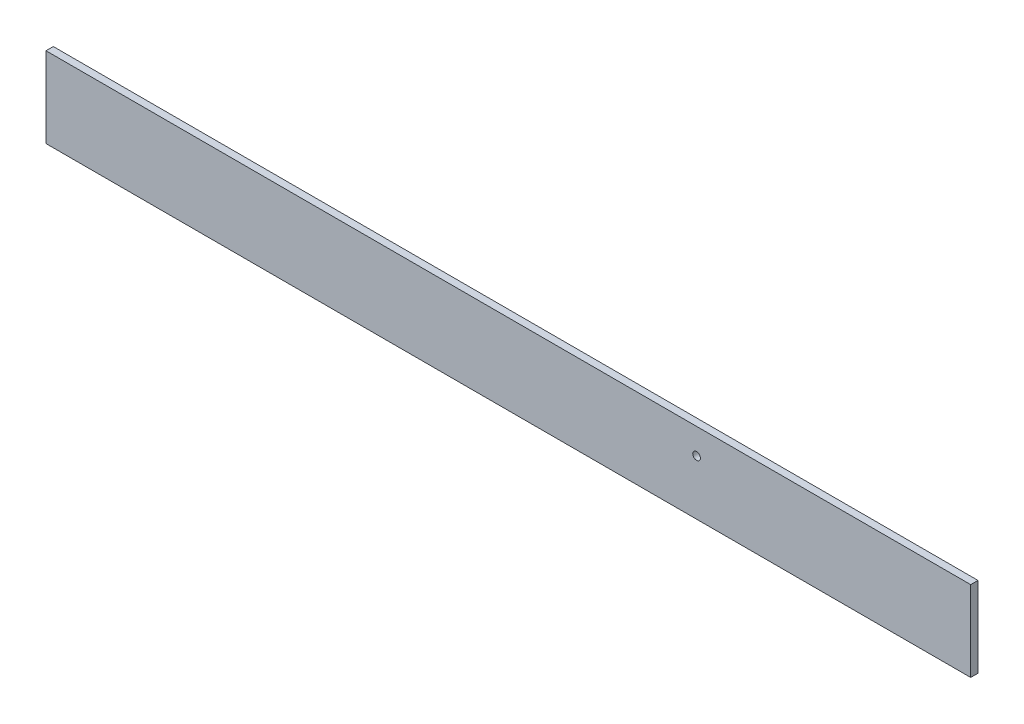
from build123d import *

# Parameters (mm, degrees)
SKETCH2_W           = 506
SKETCH2_H           = 44
SKETCH2_R           = 2.1
BOSS_EXTRUDE1_DEPTH = 4


with BuildPart() as part:
    # Sketch2 → Boss-Extrude1 (new body)
    with BuildSketch(Plane.XY):
        Rectangle(SKETCH2_W, SKETCH2_H)
        with Locations((103, 8)):
            Circle(SKETCH2_R, mode=Mode.SUBTRACT)
    extrude(amount=BOSS_EXTRUDE1_DEPTH)


solid = part.part
